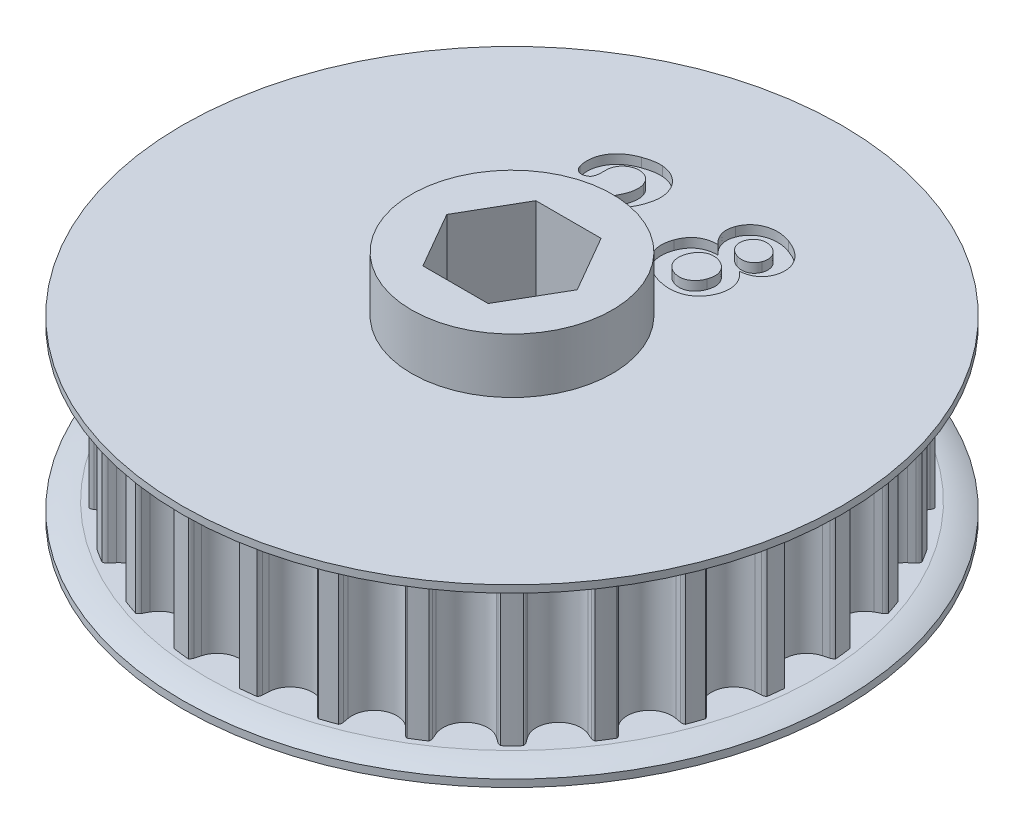
from build123d import *

# Parameters (mm, degrees)
SKETCH1_R               = 12.988015648
TOOTHOD_DEPTH           = 3.175
TOOTHPROFILE_DEPTH      = 19.640217969
TOOTHPATTERN_COUNT      = 28
SKETCH6_W               = 4.3561
SKETCH6_H               = 2.3876
BORE_DEPTH              = 22.166398917
BORE_DEPTH_BACK         = 22.166398917
LARGE_START             = 3.41
LARGE_TOOTH_COUNT_DEPTH = 0.4


# Read off the part's stored shape, not the designer's step: Large Tooth Count
with BuildPart() as part:
    # Sketch1 → ToothOD (new, symmetric)
    with BuildSketch(Plane(origin=(0, 0, 0), x_dir=(1, 0, 0), z_dir=(0, 1, 0))):
        with Locations(Location((0, 0, 0), (0, 0, 270))):
            Circle(SKETCH1_R)
    extrude(amount=TOOTHOD_DEPTH, both=True)

    # Sketch2 → ToothProfile (cut, symmetric)
    with BuildSketch(Plane(origin=(0, 0, 0), x_dir=(1, 0, 0), z_dir=(0, 1, 0))):
        with BuildLine():
            ThreePointArc((-0.937033068, 12.538077643), (-0.590385173, 12.019903033), (0, 11.819615648))
            ThreePointArc((0, 11.819615648), (0.590385173, 12.019903033), (0.937033068, 12.538077643))
            ThreePointArc((0.937033068, 12.538077643), (0.971699064, 12.664189105), (1.007805813, 12.789895648))
            ThreePointArc((1.007805813, 12.789895648), (1.046921215, 12.873107531), (1.109421329, 12.940546154))
            ThreePointArc((1.109421329, 12.940546154), (0, 12.988015648), (-1.109421329, 12.940546154))
            ThreePointArc((-1.109421329, 12.940546154), (-1.046921215, 12.873107531), (-1.007805813, 12.789895648))
            ThreePointArc((-1.007805813, 12.789895648), (-0.971699064, 12.664189105), (-0.937033068, 12.538077643))
        make_face()
    toothprofile = extrude(amount=TOOTHPROFILE_DEPTH, both=True, mode=Mode.SUBTRACT)

    # ToothPattern: ToothProfile ×28 about axis
    toothpattern_axis = Axis((0, 0, 0), (0, 1, 0))
    for i in range(1, TOOTHPATTERN_COUNT):
        add(toothprofile.rotate(toothpattern_axis, i * 360 / TOOTHPATTERN_COUNT), mode=Mode.SUBTRACT)

    # Sketch4 → Flange (revolve)
    with BuildSketch(Plane.XY, mode=Mode.PRIVATE) as flange_sk:
        with BuildLine():
            Line((0, -3.175), (13.242015648, -3.175))
            ThreePointArc((13.242015648, -3.175), (13.790399623, -3.286885048), (14.310943319, -3.4925))
            Line((14.310943319, -3.4925), (14.310943319, -3.81))
            Line((14.310943319, -3.81), (0, -3.81))
            Line((0, -3.81), (0, -3.175))
        make_face()
        with BuildLine():
            Line((14.310943319, 3.81), (14.310943319, 3.4925))
            ThreePointArc((14.310943319, 3.4925), (13.790399623, 3.286885048), (13.242015648, 3.175))
            Line((13.242015648, 3.175), (0, 3.175))
            Line((0, 3.175), (0, 3.81))
            Line((0, 3.81), (14.310943319, 3.81))
        make_face()
    revolve(flange_sk.sketch.rotate(Axis((0, 8.73125, 0), (0, -1, 0)), 90), axis=Axis((0, 8.73125, 0), (0, -1, 0)))

    # Sketch6 → TopBearingBoss (revolve)
    with BuildSketch(Plane.XY, mode=Mode.PRIVATE) as topbearingboss_sk:
        with Locations((2.17805, 5.0038)):
            Rectangle(SKETCH6_W, SKETCH6_H)
    revolve(topbearingboss_sk.sketch.rotate(Axis((0, 8.73125, 0), (0, -1, 0)), 90), axis=Axis((0, 8.73125, 0), (0, -1, 0)))

    # Sketch7 → Bore (cut, two sides: drawn at the far end of the back side and taken through both)
    with BuildSketch(Plane.XZ.offset(-BORE_DEPTH_BACK)):
        Polygon((1.415143245, 2.4511), (-1.415143245, 2.4511), (-2.83028649, 0), (-1.415143245, -2.4511), (1.415143245, -2.4511), (2.83028649, 0), align=None)
    extrude(amount=BORE_DEPTH + BORE_DEPTH_BACK, mode=Mode.SUBTRACT)

    # Large Tooth Count outline → Large Tooth Count (cut)
    # profile 1 of 2: a face of its own
    with BuildSketch(Plane(origin=(0, 0, 0), x_dir=(1, 0, 0), z_dir=(0, 1, 0)).offset(LARGE_START)):
        with BuildLine():
            add(Edge.make_bspline(
                [(1.790402344, 7.142658594), (1.75090255, 7.182469034), (1.674918957, 7.259050198), (1.582399366, 7.385797524), (1.510304479, 7.514028223), (1.4611931, 7.645945766), (1.434714614, 7.780806815), (1.431519081, 7.918314307), (1.450017384, 8.058699966), (1.479641707, 8.1497048), (1.494829688, 8.196361719)],
                knots=[0, 0, 0, 0, 0.14410249, 0.277202074, 0.40230942, 0.521516803, 0.637760285, 0.754200349, 0.873981922, 1, 1, 1, 1], degree=3))
            add(Edge.make_bspline(
                [(0.667047656, 6.36666875), (0.678752488, 6.397541866), (0.701837651, 6.458432183), (0.744539435, 6.544675592), (0.789536137, 6.626332467), (0.839749741, 6.701566934), (0.89452099, 6.771026691), (0.954297318, 6.834028223), (1.017862988, 6.891793278), (1.086292586, 6.942788841), (1.158857613, 6.988450421), (1.235734681, 7.028828885), (1.317324273, 7.062851628), (1.403500877, 7.09024564), (1.493791063, 7.112910447), (1.588804586, 7.128434936), (1.688048032, 7.139717545), (1.755841624, 7.141665526), (1.790402344, 7.142658594)],
                knots=[0, 0, 0, 0, 0.067517043, 0.13316227, 0.196694169, 0.258178886, 0.318006423, 0.377460812, 0.4356764, 0.493534088, 0.551829263, 0.610942668, 0.671002246, 0.732441701, 0.795809918, 0.861291081, 0.92928712, 1, 1, 1, 1], degree=3))
            add(Edge.make_bspline(
                [(1.699319531, 4.561978906), (1.660749947, 4.576438653), (1.584618355, 4.604980407), (1.475537671, 4.654260794), (1.372036367, 4.706196774), (1.274755006, 4.761442384), (1.183118433, 4.820236514), (1.098656816, 4.883888341), (1.019542336, 4.949918575), (0.946975657, 5.019696915), (0.881505963, 5.092591384), (0.821827551, 5.167204118), (0.768927304, 5.244167549), (0.722912765, 5.323523168), (0.68206984, 5.403987353), (0.649067759, 5.486876398), (0.621996711, 5.571532198), (0.596360031, 5.687153163), (0.577863838, 5.834119644), (0.581848, 6.012347284), (0.610312237, 6.191572326), (0.647892359, 6.307551815), (0.667047656, 6.36666875)],
                knots=[0, 0, 0, 0, 0.052742704, 0.104107579, 0.153208561, 0.201013791, 0.24732896, 0.292542174, 0.33637463, 0.379243249, 0.421350801, 0.461776711, 0.501535636, 0.540831293, 0.579191204, 0.616993928, 0.654973086, 0.692890969, 0.768547339, 0.844045065, 0.920506826, 1, 1, 1, 1], degree=3))
            add(Edge.make_bspline(
                [(3.641526563, 5.290641406), (3.618454624, 5.232997932), (3.572962584, 5.119339553), (3.477118781, 4.964267034), (3.364943543, 4.823809604), (3.255406339, 4.722138561), (3.159841142, 4.650172599), (3.08421965, 4.602229094), (3.004826842, 4.559853193), (2.921938497, 4.523156754), (2.834872843, 4.493065266), (2.744625742, 4.467706878), (2.650495957, 4.449342576), (2.553346229, 4.435834951), (2.453107232, 4.428418207), (2.350825486, 4.429173093), (2.246405334, 4.433925745), (2.140621109, 4.446913841), (2.032595175, 4.465462101), (1.923233304, 4.492089602), (1.811079471, 4.522583801), (1.736972973, 4.54870616), (1.699319531, 4.561978906)],
                knots=[0, 0, 0, 0, 0.079704193, 0.157156546, 0.233365861, 0.310271619, 0.348544086, 0.387085429, 0.42526785, 0.464166687, 0.503505496, 0.54361862, 0.584600552, 0.626710702, 0.669685076, 0.713698413, 0.758153823, 0.804012161, 0.850637074, 0.899002935, 0.948683486, 1, 1, 1, 1], degree=3))
            add(Edge.make_bspline(
                [(3.278088281, 6.601519531), (3.312006603, 6.570855219), (3.378308996, 6.510913655), (3.465659186, 6.413229751), (3.541129396, 6.312800537), (3.601670777, 6.207804346), (3.650330947, 6.100440973), (3.686110523, 5.99047719), (3.711031346, 5.878396052), (3.720952965, 5.763846488), (3.720496924, 5.647436474), (3.70639122, 5.529701997), (3.681949841, 5.409439605), (3.655215987, 5.330872656), (3.641526563, 5.290641406)],
                knots=[0, 0, 0, 0, 0.094089648, 0.183923277, 0.269359332, 0.352296846, 0.432945115, 0.511632039, 0.590008069, 0.668799941, 0.747863074, 0.829283115, 0.912582152, 1, 1, 1, 1], degree=3))
            add(Edge.make_bspline(
                [(4.17195, 7.230169531), (4.154393633, 7.185959169), (4.119943511, 7.09920703), (4.043050162, 6.983117889), (3.954013787, 6.878880113), (3.846999887, 6.790842581), (3.725606298, 6.718295007), (3.589450633, 6.66155202), (3.438904286, 6.621356508), (3.332783562, 6.608266304), (3.278088281, 6.601519531)],
                knots=[0, 0, 0, 0, 0.122848661, 0.241060771, 0.358504239, 0.476711325, 0.598037422, 0.72341497, 0.857446358, 1, 1, 1, 1], degree=3))
            add(Edge.make_bspline(
                [(3.204864844, 8.803580469), (3.259429949, 8.78276242), (3.365514394, 8.742288365), (3.513658581, 8.668243691), (3.648658788, 8.589237425), (3.768516981, 8.502387674), (3.874427762, 8.410117451), (3.966968946, 8.313410964), (4.046433823, 8.212446755), (4.110537403, 8.106342517), (4.162529791, 7.998744878), (4.201389673, 7.889455074), (4.227806979, 7.779320568), (4.239820966, 7.668055603), (4.240939296, 7.557029057), (4.229966357, 7.446630748), (4.208022905, 7.336905722), (4.184047159, 7.26596384), (4.17195, 7.230169531)],
                knots=[0, 0, 0, 0, 0.084482799, 0.16424986, 0.239393101, 0.310662141, 0.378142675, 0.442439946, 0.504144579, 0.563698559, 0.62150813, 0.676832122, 0.731276826, 0.785038821, 0.838463139, 0.891706488, 0.94535962, 1, 1, 1, 1], degree=3))
            add(Edge.make_bspline(
                [(1.494829688, 8.196361719), (1.513830831, 8.242207308), (1.551640611, 8.333434006), (1.630605138, 8.459813967), (1.72847613, 8.573912422), (1.842576519, 8.676815287), (1.973133778, 8.764411214), (2.118554709, 8.834079193), (2.277929303, 8.882426337), (2.449020171, 8.913065529), (2.629982714, 8.921738504), (2.817986267, 8.906973609), (3.011586184, 8.868248088), (3.139194, 8.825552771), (3.204864844, 8.803580469)],
                knots=[0, 0, 0, 0, 0.073407972, 0.14607222, 0.219566183, 0.295423211, 0.372941414, 0.451616763, 0.533326273, 0.618850953, 0.708450599, 0.800856383, 0.897514667, 1, 1, 1, 1], degree=3))
        make_face()
        with BuildLine():
            add(Edge.make_bspline(
                [(1.902023438, 5.135264844), (1.934213029, 5.124412568), (1.997304432, 5.103142173), (2.095007766, 5.089226698), (2.191297105, 5.084299439), (2.28624343, 5.095832051), (2.378584738, 5.118723047), (2.466476514, 5.154896788), (2.549670763, 5.202543518), (2.626478558, 5.263062592), (2.697436462, 5.333990073), (2.757788565, 5.417601993), (2.811616221, 5.509538087), (2.837858078, 5.576861999), (2.851249219, 5.611217188)],
                knots=[0, 0, 0, 0, 0.085405706, 0.167394663, 0.247692515, 0.327692154, 0.407357177, 0.486735779, 0.566358434, 0.648113842, 0.73242938, 0.818222714, 0.9072396, 1, 1, 1, 1], degree=3))
            add(Edge.make_bspline(
                [(1.477863281, 6.105028906), (1.466315803, 6.069840469), (1.443819057, 6.00128651), (1.424657881, 5.896538594), (1.420576672, 5.794183407), (1.427918125, 5.6946744), (1.449926873, 5.59963911), (1.48258034, 5.509853532), (1.528208287, 5.426536111), (1.584402995, 5.35007325), (1.650121034, 5.280720717), (1.726759201, 5.223017879), (1.809626346, 5.171364932), (1.870905299, 5.147422884), (1.902023438, 5.135264844)],
                knots=[0, 0, 0, 0, 0.093627614, 0.182404903, 0.268338604, 0.352204852, 0.43405191, 0.514349495, 0.593203882, 0.67348734, 0.753911956, 0.833898172, 0.915651632, 1, 1, 1, 1], degree=3))
            add(Edge.make_bspline(
                [(2.404764844, 6.570265625), (2.381359387, 6.57805801), (2.335342581, 6.593378396), (2.265267444, 6.610050992), (2.19570232, 6.617581453), (2.127021058, 6.619426925), (2.058937681, 6.615600128), (1.991566861, 6.602169711), (1.924618243, 6.584021224), (1.859588178, 6.557765023), (1.796693286, 6.525846391), (1.737571304, 6.486395429), (1.683029664, 6.439927296), (1.633198273, 6.385918283), (1.587316275, 6.325926291), (1.545520795, 6.258761155), (1.50933489, 6.184525516), (1.488526759, 6.131964622), (1.477863281, 6.105028906)],
                knots=[0, 0, 0, 0, 0.063358342, 0.124567041, 0.184603966, 0.242736041, 0.300973623, 0.35931151, 0.418864436, 0.478925702, 0.539113383, 0.599765541, 0.661055378, 0.722730346, 0.788185618, 0.85480951, 0.925594685, 1, 1, 1, 1], degree=3))
            add(Edge.make_bspline(
                [(2.851249219, 5.611217188), (2.862852986, 5.646103311), (2.885544727, 5.714324854), (2.903807972, 5.817957624), (2.910147485, 5.918822441), (2.900654878, 6.016137075), (2.879722567, 6.109892189), (2.844453375, 6.19753353), (2.79739675, 6.279684011), (2.737095731, 6.353928916), (2.667620614, 6.4221769), (2.588323412, 6.480990219), (2.500888581, 6.532275242), (2.43730353, 6.557405564), (2.404764844, 6.570265625)],
                knots=[0, 0, 0, 0, 0.092496771, 0.180882017, 0.264226291, 0.346292765, 0.426316577, 0.505397049, 0.58332828, 0.663887678, 0.745538693, 0.828011719, 0.911987602, 1, 1, 1, 1], degree=3))
        make_face(mode=Mode.SUBTRACT)
        with BuildLine():
            add(Edge.make_bspline(
                [(3.400425, 7.4596625), (3.408879863, 7.485671577), (3.425454076, 7.536657617), (3.437756002, 7.615173678), (3.439816345, 7.692678843), (3.430581921, 7.768948211), (3.411888272, 7.843126678), (3.38349824, 7.914513349), (3.343036764, 7.980646554), (3.295416441, 8.043840617), (3.23659704, 8.09939673), (3.171306997, 8.150457966), (3.096375213, 8.192460695), (3.042319063, 8.213944853), (3.0146625, 8.224936719)],
                knots=[0, 0, 0, 0, 0.085384447, 0.167380595, 0.247426401, 0.327065536, 0.406731847, 0.486044145, 0.566154827, 0.648419807, 0.732650563, 0.818262871, 0.907018455, 1, 1, 1, 1], degree=3))
            add(Edge.make_bspline(
                [(2.624435156, 7.137300781), (2.666942622, 7.124141404), (2.748943941, 7.098755599), (2.874230662, 7.086990825), (2.992046208, 7.098546525), (3.101235356, 7.130732774), (3.199300069, 7.183980768), (3.283403973, 7.258068942), (3.354110392, 7.350185146), (3.384704214, 7.422502084), (3.400425, 7.4596625)],
                knots=[0, 0, 0, 0, 0.141543659, 0.273052424, 0.397950684, 0.516815029, 0.633574399, 0.750584058, 0.871836387, 1, 1, 1, 1], degree=3))
            add(Edge.make_bspline(
                [(2.229742969, 7.880250781), (2.218207196, 7.84308324), (2.195764783, 7.770775184), (2.191314698, 7.657493211), (2.208841286, 7.546400353), (2.253013043, 7.440241642), (2.316549716, 7.341662042), (2.402204712, 7.257835897), (2.504464951, 7.18591653), (2.583445719, 7.153911007), (2.624435156, 7.137300781)],
                knots=[0, 0, 0, 0, 0.123602534, 0.240464085, 0.357783248, 0.479550726, 0.604309923, 0.729119637, 0.859418514, 1, 1, 1, 1], degree=3))
            add(Edge.make_bspline(
                [(3.0146625, 8.224936719), (2.972479182, 8.238436344), (2.890918751, 8.264537544), (2.765656254, 8.276549542), (2.646033088, 8.262726887), (2.533983717, 8.226318061), (2.433388082, 8.16763697), (2.346503451, 8.090620556), (2.277008416, 7.993221764), (2.245866785, 7.918788942), (2.229742969, 7.880250781)],
                knots=[0, 0, 0, 0, 0.137752016, 0.266340214, 0.38866187, 0.510701777, 0.630833332, 0.749091242, 0.870090081, 1, 1, 1, 1], degree=3))
        make_face(mode=Mode.SUBTRACT)
    # profile 2 of 2: a face of its own
    with BuildSketch(Plane(origin=(0, 0, 0), x_dir=(1, 0, 0), z_dir=(0, 1, 0)).offset(LARGE_START)):
        with BuildLine():
            add(Edge.make_bspline(
                [(-2.234168115, 5.353011292), (-2.247244256, 5.316873897), (-2.275021933, 5.240107144), (-2.295020976, 5.160948672), (-2.305605615, 5.11905348)],
                knots=[0, 0, 0, 0, 0.470742786, 1, 1, 1, 1], degree=3))
            add(Edge.make_bspline(
                [(-1.29476499, 8.103355042), (-1.276165988, 8.045725653), (-1.239414504, 7.931850426), (-1.213223505, 7.755459749), (-1.210905963, 7.579312338), (-1.234913106, 7.406881667), (-1.272316569, 7.242973601), (-1.316989891, 7.091211231), (-1.367220408, 6.954174159), (-1.417166225, 6.848590713), (-1.462388692, 6.765550496), (-1.500514149, 6.695571515), (-1.545860758, 6.618317577), (-1.594478047, 6.531076031), (-1.650267057, 6.435942782), (-1.710447908, 6.331271217), (-1.777807412, 6.219335064), (-1.847619045, 6.101084694), (-1.917342443, 5.983302217), (-1.982034803, 5.870232875), (-2.039893335, 5.765043772), (-2.092002397, 5.667564163), (-2.137382047, 5.57800021), (-2.176069399, 5.496113822), (-2.208669951, 5.422530554), (-2.226056627, 5.375126793), (-2.234168115, 5.353011292)],
                knots=[0, 0, 0, 0, 0.060450493, 0.119449708, 0.177475226, 0.235972593, 0.293000807, 0.345441604, 0.3940236, 0.438747422, 0.462043983, 0.488546083, 0.518403673, 0.551582956, 0.588379575, 0.628645837, 0.672276409, 0.718969184, 0.765918185, 0.809098992, 0.849184549, 0.885923376, 0.919590071, 0.949537965, 0.976457708, 1, 1, 1, 1], degree=3))
            add(Edge.make_bspline(
                [(-2.35918374, 8.895418323), (-2.320077584, 8.891745214), (-2.242463663, 8.8844552), (-2.128299384, 8.859540815), (-2.017297506, 8.824876127), (-1.91003333, 8.779150369), (-1.807455281, 8.723520447), (-1.709605795, 8.659951214), (-1.620067746, 8.584410603), (-1.536370677, 8.502023993), (-1.460407095, 8.4119645), (-1.393964983, 8.315256613), (-1.338140878, 8.212159778), (-1.3092479, 8.139684193), (-1.29476499, 8.103355042)],
                knots=[0, 0, 0, 0, 0.083961959, 0.166639157, 0.249411935, 0.332439052, 0.415632048, 0.498815296, 0.581568477, 0.665769146, 0.749827635, 0.833193476, 0.916386472, 1, 1, 1, 1], degree=3))
            add(Edge.make_bspline(
                [(-3.147675146, 8.760580042), (-3.077795383, 8.784170319), (-2.942536221, 8.829831622), (-2.740207183, 8.87545666), (-2.546416061, 8.899993833), (-2.42055687, 8.896918136), (-2.35918374, 8.895418323)],
                knots=[0, 0, 0, 0, 0.274607575, 0.531530002, 0.771558439, 1, 1, 1, 1], degree=3))
            add(Edge.make_bspline(
                [(-4.134405615, 7.075548011), (-4.145339146, 7.108670881), (-4.167577009, 7.176039949), (-4.18612435, 7.282986848), (-4.196002458, 7.395590609), (-4.196089037, 7.513373342), (-4.184670259, 7.634265586), (-4.160477107, 7.755171976), (-4.123343583, 7.874704108), (-4.07429709, 7.992786777), (-4.011615363, 8.108790883), (-3.933354158, 8.220475349), (-3.840676054, 8.327864481), (-3.734096567, 8.431255642), (-3.61121412, 8.527692482), (-3.472184031, 8.616487234), (-3.316257543, 8.694898817), (-3.204916717, 8.738278209), (-3.147675146, 8.760580042)],
                knots=[0, 0, 0, 0, 0.048061101, 0.097752146, 0.149277212, 0.203888834, 0.259986841, 0.316517477, 0.37366511, 0.432382869, 0.492648036, 0.555182764, 0.620118176, 0.688069471, 0.759701263, 0.835220702, 0.915285109, 1, 1, 1, 1], degree=3))
            add(Edge.make_bspline(
                [(-3.681670458, 6.848733948), (-3.704679912, 6.841445789), (-3.74910053, 6.827375724), (-3.818485889, 6.823707464), (-3.886021016, 6.831027073), (-3.950794994, 6.853926915), (-4.010694226, 6.889764471), (-4.061749181, 6.94005991), (-4.105196196, 7.002212897), (-4.124366763, 7.0503438), (-4.134405615, 7.075548011)],
                knots=[0, 0, 0, 0, 0.126686305, 0.244572685, 0.363041841, 0.482575468, 0.603612079, 0.72783784, 0.85747966, 1, 1, 1, 1], degree=3))
            add(Edge.make_bspline(
                [(-3.420923583, 7.64794098), (-3.42295389, 7.635761288), (-3.428074553, 7.605042713), (-3.428903957, 7.548494743), (-3.431477718, 7.472353435), (-3.430462983, 7.381240991), (-3.431024562, 7.284922356), (-3.439285051, 7.193636538), (-3.451959553, 7.111813885), (-3.471700563, 7.03938252), (-3.502328215, 6.97546242), (-3.548858, 6.922557632), (-3.609320913, 6.87871497), (-3.656747969, 6.859061611), (-3.681670458, 6.848733948)],
                knots=[0, 0, 0, 0, 0.04090481, 0.103166604, 0.187098754, 0.293712448, 0.405279432, 0.506361345, 0.59740547, 0.679577595, 0.75462802, 0.830221827, 0.910783106, 1, 1, 1, 1], degree=3))
            add(Edge.make_bspline(
                [(-2.956579833, 8.182829261), (-2.986417301, 8.171119855), (-3.044853951, 8.148186997), (-3.124716313, 8.100951297), (-3.196044635, 8.04600104), (-3.259114393, 7.983230452), (-3.313278552, 7.911587685), (-3.358752639, 7.831749166), (-3.396078149, 7.743376678), (-3.412488371, 7.680342122), (-3.420923583, 7.64794098)],
                knots=[0, 0, 0, 0, 0.129599321, 0.253820137, 0.37410284, 0.493403527, 0.612953512, 0.736570756, 0.864591601, 1, 1, 1, 1], degree=3))
            add(Edge.make_bspline(
                [(-2.088614208, 7.795280823), (-2.10041462, 7.824180865), (-2.123474836, 7.880656963), (-2.169460829, 7.958676633), (-2.225689595, 8.027017432), (-2.289798527, 8.08708322), (-2.361586797, 8.13651574), (-2.437582686, 8.178126706), (-2.520111318, 8.205022766), (-2.605718344, 8.223101754), (-2.693681849, 8.230402295), (-2.782118594, 8.225488457), (-2.870411826, 8.210654833), (-2.92759843, 8.192188003), (-2.956579833, 8.182829261)],
                knots=[0, 0, 0, 0, 0.088177752, 0.172315852, 0.254852227, 0.337615651, 0.419790889, 0.500724464, 0.581623032, 0.664142246, 0.747723021, 0.830297996, 0.913997302, 1, 1, 1, 1], degree=3))
            add(Edge.make_bspline(
                [(-2.421691552, 6.537087855), (-2.394101617, 6.577246149), (-2.340429672, 6.65536789), (-2.270430436, 6.774743448), (-2.208307273, 6.88966119), (-2.156003054, 7.001630337), (-2.113930191, 7.111208962), (-2.080175065, 7.218036078), (-2.058074603, 7.323112767), (-2.044554297, 7.425186422), (-2.039223617, 7.524185941), (-2.046128399, 7.618947952), (-2.06019596, 7.709840933), (-2.079177534, 7.76690932), (-2.088614208, 7.795280823)],
                knots=[0, 0, 0, 0, 0.108194894, 0.210476411, 0.307204584, 0.398316852, 0.484760872, 0.567789504, 0.646894938, 0.722920206, 0.796386638, 0.866625358, 0.9336929, 1, 1, 1, 1], degree=3))
            add(Edge.make_bspline(
                [(-3.154818896, 5.103873011), (-3.11661252, 5.18849473), (-3.042569648, 5.352489218), (-2.932038894, 5.588947436), (-2.82571196, 5.808020549), (-2.739559515, 5.978830003), (-2.674082467, 6.105191293), (-2.628801437, 6.190181685), (-2.585252491, 6.266567099), (-2.547763844, 6.336469266), (-2.511599078, 6.397562889), (-2.478440267, 6.450883151), (-2.449731141, 6.49723843), (-2.430435705, 6.524660802), (-2.421691552, 6.537087855)],
                knots=[0, 0, 0, 0, 0.172852609, 0.334983449, 0.485917487, 0.626186052, 0.691123185, 0.750873662, 0.805450966, 0.854807533, 0.898525605, 0.937588166, 0.9717167, 1, 1, 1, 1], degree=3))
            add(Edge.make_bspline(
                [(-3.210182958, 4.503798011), (-3.215467059, 4.521846109), (-3.226997326, 4.561228284), (-3.233627179, 4.627758155), (-3.235475642, 4.705072849), (-3.229675857, 4.790717489), (-3.21877737, 4.878134962), (-3.202438734, 4.960986403), (-3.18314717, 5.03623978), (-3.163969513, 5.082026082), (-3.154818896, 5.103873011)],
                knots=[0, 0, 0, 0, 0.091935334, 0.200609136, 0.326015774, 0.470605022, 0.620505763, 0.757168366, 0.884132909, 1, 1, 1, 1], degree=3))
            add(Edge.make_bspline(
                [(-2.625288427, 4.291271448), (-2.659218597, 4.280201526), (-2.723684156, 4.259169248), (-2.821584528, 4.24829007), (-2.913052325, 4.254756078), (-2.996978822, 4.280040881), (-3.069878393, 4.320312966), (-3.131194143, 4.37091083), (-3.17967359, 4.432329813), (-3.199901652, 4.479714049), (-3.210182958, 4.503798011)],
                knots=[0, 0, 0, 0, 0.153566226, 0.291767842, 0.421813148, 0.546476879, 0.666535793, 0.778617601, 0.887478079, 1, 1, 1, 1], degree=3))
            Line((-2.625288427, 4.291271448), (-0.535741552, 5.052080823))
            add(Edge.make_bspline(
                [(-0.267850927, 5.502137073), (-0.261281147, 5.480602177), (-0.248517794, 5.438765546), (-0.244906044, 5.372799428), (-0.256135704, 5.308110852), (-0.280397509, 5.244438892), (-0.320236672, 5.184870064), (-0.377019805, 5.13179069), (-0.450138584, 5.086625364), (-0.506166254, 5.064015749), (-0.535741552, 5.052080823)],
                knots=[0, 0, 0, 0, 0.114153353, 0.221769891, 0.332232334, 0.445772145, 0.565812396, 0.693192754, 0.838045817, 1, 1, 1, 1], degree=3))
            add(Edge.make_bspline(
                [(-0.833993115, 5.65483473), (-0.799115243, 5.666466741), (-0.733235695, 5.688438027), (-0.636204632, 5.705664802), (-0.547879447, 5.709014613), (-0.469109879, 5.694242936), (-0.399653762, 5.667368315), (-0.342777949, 5.624360799), (-0.295903877, 5.569739845), (-0.277396591, 5.525140477), (-0.267850927, 5.502137073)],
                knots=[0, 0, 0, 0, 0.166922232, 0.31529336, 0.446564992, 0.566252556, 0.677308071, 0.781763252, 0.887438135, 1, 1, 1, 1], degree=3))
            Line((-0.833993115, 5.65483473), (-2.305605615, 5.11905348))
        make_face()
    extrude(amount=LARGE_TOOTH_COUNT_DEPTH, mode=Mode.SUBTRACT)


solid = part.part
